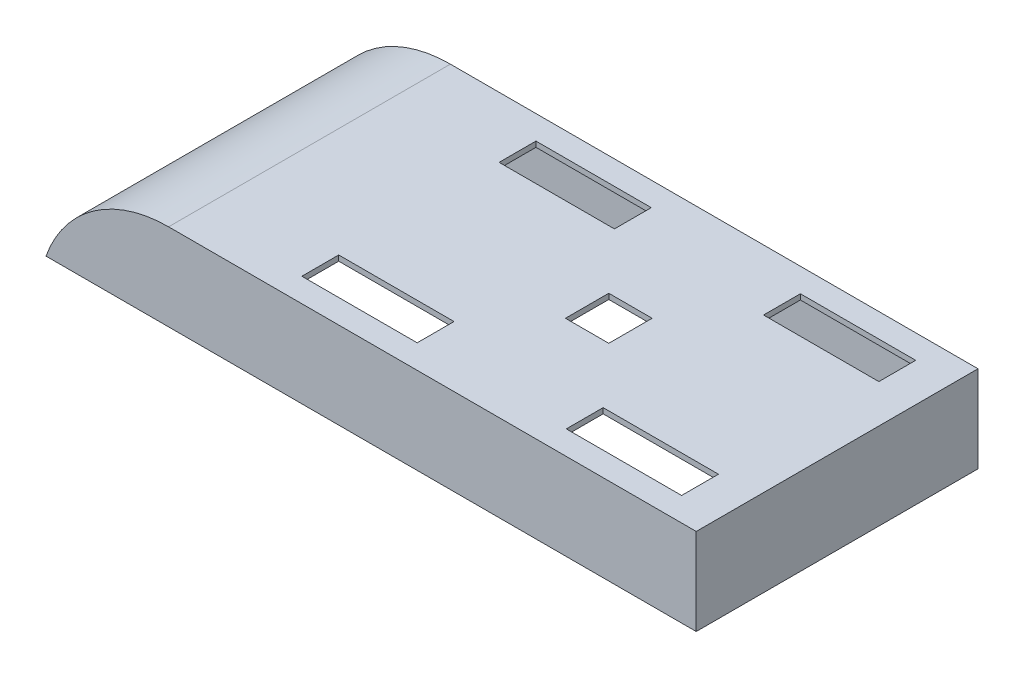
from build123d import *

# Parameters (mm, degrees)
SKETCH1_W           = 762
SKETCH1_H           = 330.2
BOSS_EXTRUDE1_DEPTH = 101.6
FILLET1_R           = 152.4
SHELL1_T            = -6.35
SKETCH3_W           = 135.128
SKETCH3_H           = 43.18
SKETCH3_W_2         = 50.8
SKETCH3_H_2         = 50.8
CUT_EXTRUDE1_DEPTH  = 127.762


with BuildPart() as part:
    # Sketch1 → Boss-Extrude1 (new body)
    with BuildSketch(Plane(origin=(0, 0, 0), x_dir=(1, 0, 0), z_dir=(0, 1, 0))):
        with Locations((381, 165.1)):
            Rectangle(SKETCH1_W, SKETCH1_H)
    extrude(amount=BOSS_EXTRUDE1_DEPTH)

    # Fillet1
    # the kernel refuses this fillet: 152.4 mm, written as the material it takes off along each edge
    with BuildSketch(Plane(origin=(0, 101.6, -689.410244843), x_dir=(0, -1, 0), z_dir=(0, 0, 1))) as fillet1_piece_1:
        with BuildLine():
            CenterArc((152.4, 143.684097937), FILLET1_R, 180, 70.528779366)
            Line((0, 143.684097937), (-3.048, 143.684097937))
            Line((-3.048, 143.684097937), (-3.048, 0))
            Line((-3.048, 0), (0, -3.048))
            ThreePointArc((0, -3.048), (50.8, -3.048), (100.584, -2.873681959))
            Line((100.584, -2.873681959), (101.6, 0))
        make_face()
    extrude(amount=1048.620489686, mode=Mode.SUBTRACT)

    # Shell1
    shell1_openings = [part.faces().sort_by_distance(p)[0] for p in [
        (381, 0, -165.1),
    ]]
    offset(amount=SHELL1_T, openings=shell1_openings, kind=Kind.INTERSECTION)

    # Sketch3 → Cut-Extrude1 (cut)
    with BuildSketch(Plane(origin=(0, 101.6, 0), x_dir=(1, 0, 0), z_dir=(0, 1, 0))):
        with Locations((339.485069024, 49.525)):
            Rectangle(SKETCH3_W, SKETCH3_H)
        with Locations((649.365069024, 280.675)):
            Rectangle(SKETCH3_W, SKETCH3_H)
        with Locations((649.365069024, 49.525)):
            Rectangle(SKETCH3_W, SKETCH3_H)
        with Locations((339.485069024, 280.675)):
            Rectangle(SKETCH3_W, SKETCH3_H)
        with Locations((494.425069024, 165.1)):
            Rectangle(SKETCH3_W_2, SKETCH3_H_2)
    extrude(amount=-CUT_EXTRUDE1_DEPTH, mode=Mode.SUBTRACT)


solid = part.part
